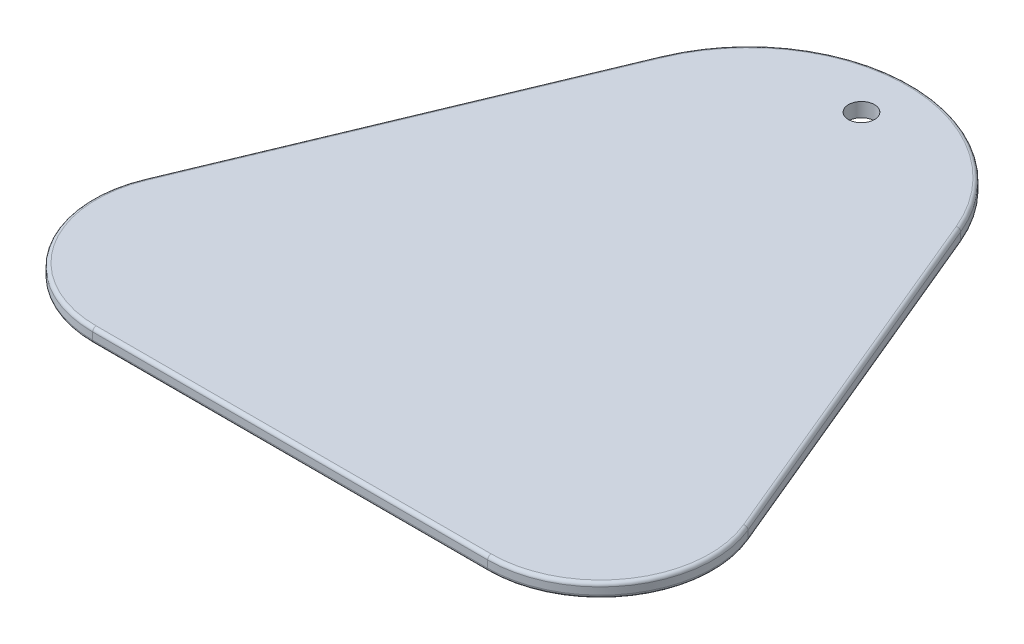
from build123d import *

# Parameters (mm, degrees)
SKETCH1_R           = 11.7094
BOSS_EXTRUDE1_DEPTH = 12.7
FILLET2_R           = 3.175
FILLET3_R           = 3.175


with BuildPart() as part:
    # Sketch1 → Boss-Extrude1 (new body)
    with BuildSketch(Plane(origin=(0, 0, 0), x_dir=(1, 0, 0), z_dir=(0, 1, 0))):
        with BuildLine():
            Line((134.815384615, 367.323076923), (271.584615385, 39.076923077))
            ThreePointArc((271.584615385, 39.076923077), (262.336309905, -56.357539936), (177.8, -101.6))
            Line((177.8, -101.6), (-177.8, -101.6))
            ThreePointArc((-177.8, -101.6), (-262.336309905, -56.357539936), (-271.584615385, 39.076923077))
            Line((-271.584615385, 39.076923077), (-134.815384615, 367.323076923))
            ThreePointArc((-134.815384615, 367.323076923), (0, 457.2), (134.815384615, 367.323076923))
        make_face()
        with Locations((0, 412.75)):
            Circle(SKETCH1_R, mode=Mode.SUBTRACT)
    extrude(amount=BOSS_EXTRUDE1_DEPTH)

    # Fillet2
    fillet2_edges = [part.edges().sort_by_distance(p)[0] for p in [
        (-262.336309905, 12.7, 56.357539936),
        (-203.2, 12.7, -203.2),
        (0, 12.7, -457.2),
        (203.2, 12.7, -203.2),
        (262.336309905, 12.7, 56.357539936),
        (0, 12.7, 101.6),
    ]]
    fillet(fillet2_edges, radius=FILLET2_R)

    # Fillet3
    fillet3_edges = [part.edges().sort_by_distance(p)[0] for p in [
        (-262.336309905, 0, 56.357539936),
        (-203.2, 0, -203.2),
        (0, 0, -457.2),
        (203.2, 0, -203.2),
        (262.336309905, 0, 56.357539936),
        (0, 0, 101.6),
    ]]
    fillet(fillet3_edges, radius=FILLET3_R)


solid = part.part
